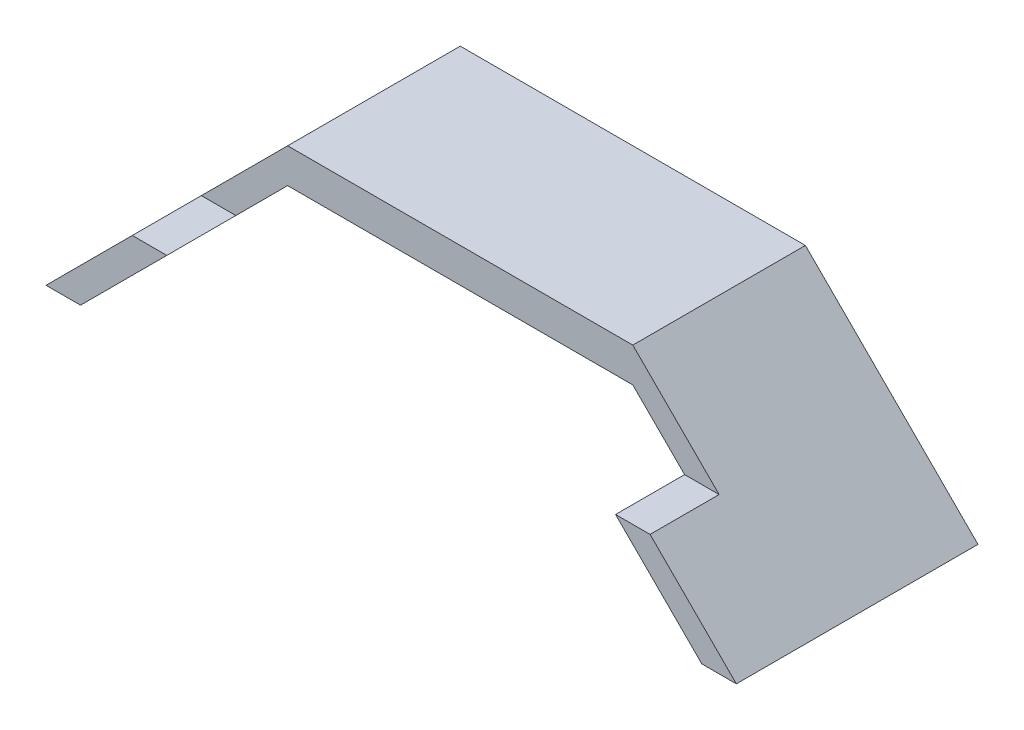
from build123d import *
from OCP.BRepAlgoAPI import BRepAlgoAPI_Cut
from OCP.TopTools import TopTools_ListOfShape

# Parameters (mm, degrees)
EXTRUDE_1_DEPTH     = 70
CUT_EXTRUDE_1_DEPTH = 20


with BuildPart() as part:
    # 草图2 → 凸台-拉伸1 (new body)
    with BuildSketch(Plane.XY):
        Polygon((-150.888329598, 26.350410604), (-100.888333902, 76.350410604), (-0.888333902, 76.350410604), (49.111670402, 26.350410604), (39.111670402, 26.350410604), (-0.888329598, 66.350410604), (-100.888329598, 66.350410604), (-140.888329598, 26.350410604), align=None)
    extrude(amount=EXTRUDE_1_DEPTH)


with BuildPart() as cut_extrude_1_tool:
    # 草图3 → 切除-拉伸1 (new body)
    with BuildSketch(Plane.XY.offset(70)):
        Polygon((-100.888333902, 76.350410604), (-0.888333902, 76.350410604), (24.111669326, 51.350411681), (14.111669326, 51.350411681), (-0.888329598, 66.350410604), (-100.888329598, 66.350410604), (-115.888330674, 51.350409528), (-125.888330674, 51.350409528), align=None)
    extrude(amount=-CUT_EXTRUDE_1_DEPTH)


with BuildPart() as part_1:
    add(part.part)

    # 切除-拉伸1: cut by cut_extrude_1_tool, with a tolerance
    cut_extrude_1_stock = TopTools_ListOfShape()
    cut_extrude_1_stock.Append(part_1.part.wrapped)
    cut_extrude_1_tools = TopTools_ListOfShape()
    cut_extrude_1_tools.Append(cut_extrude_1_tool.part.wrapped)
    cut_extrude_1_cut = BRepAlgoAPI_Cut()
    cut_extrude_1_cut.SetArguments(cut_extrude_1_stock)
    cut_extrude_1_cut.SetTools(cut_extrude_1_tools)
    cut_extrude_1_cut.SetFuzzyValue(0.00001)
    cut_extrude_1_cut.Build()
    add(Compound.cast(cut_extrude_1_cut.Shape()).solids(), mode=Mode.REPLACE)


solid = part_1.part
